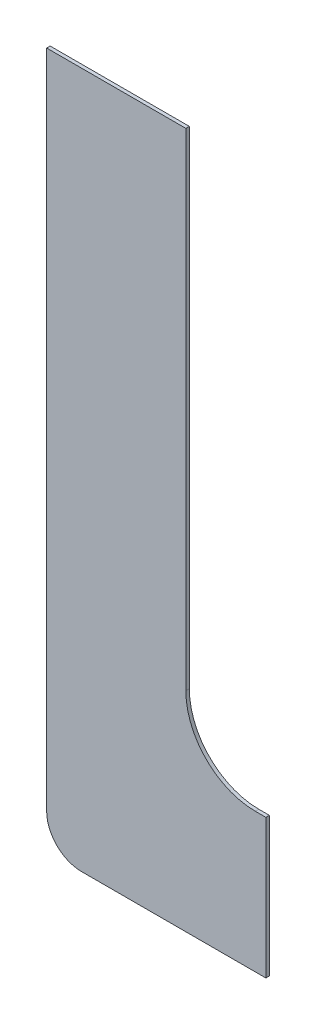
from build123d import *

# Parameters (mm, degrees)
EXTRUDE_1_DEPTH = 0.5
FILLET_1_R      = 10
FILLET_2_R      = 5


with BuildPart() as part:
    # 草图1 → 凸台-拉伸1 (new body)
    with BuildSketch(Plane.XY):
        Polygon((0, 0), (-31.5, 0), (-31.5, 100), (-11.5, 100), (-11.5, 20), (0, 20), align=None)
    extrude(amount=EXTRUDE_1_DEPTH)

    # 圆角1
    fillet_1_edges = [part.edges().sort_by_distance(p)[0] for p in [
        (-11.5, 20, 0.25),
    ]]
    fillet(fillet_1_edges, radius=FILLET_1_R)

    # 圆角2
    fillet_2_edges = [part.edges().sort_by_distance(p)[0] for p in [
        (-31.5, 0, 0.25),
    ]]
    fillet(fillet_2_edges, radius=FILLET_2_R)


solid = part.part
